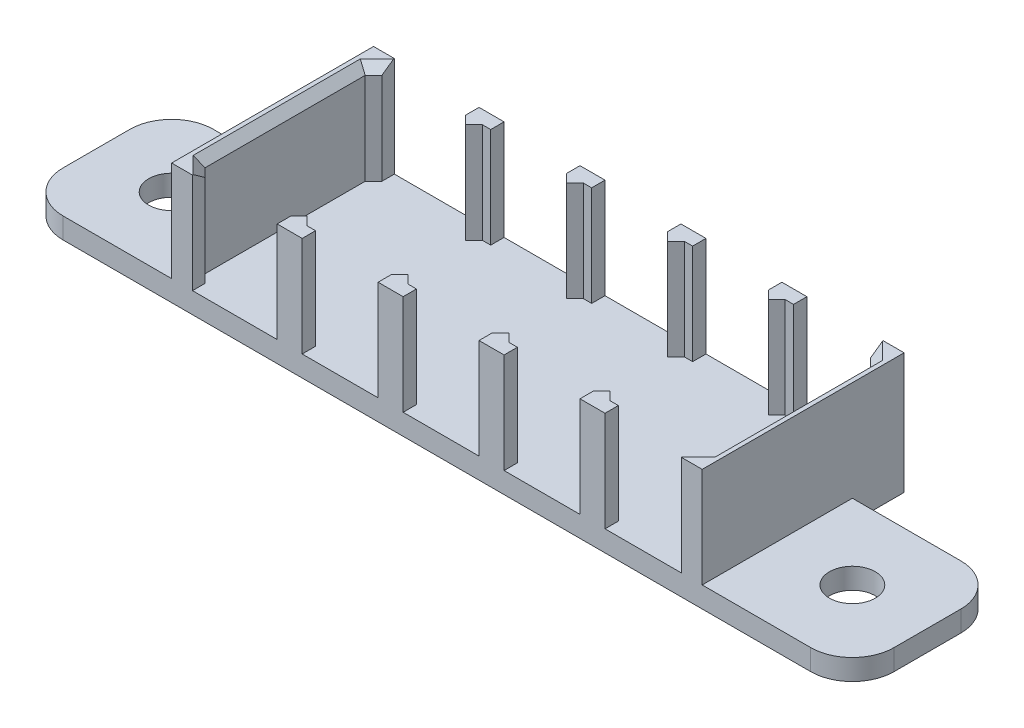
from build123d import *

# Parameters (mm, degrees)
SKETCH_1_W                    = 63.6
SKETCH_1_H                    = 24.2
EXTRUDE_1_DEPTH               = 2.5
SKETCH_2_R                    = 2.75
EXTRUDE_2_DEPTH               = 2.5
EXTRUDE_3_DEPTH               = 12
CHAMFER_1_SIZE                = 1
EXTRUDE_4_DEPTH               = 12
PATTERN_LINEAR_1_COPY_1_DEPTH = 12
PATTERN_LINEAR_1_COPY_2_DEPTH = 12
PATTERN_LINEAR_1_COPY_3_DEPTH = 12
PATTERN_LINEAR_1_COPY_4_DEPTH = 12
PATTERN_LINEAR_1_COPY_5_DEPTH = 12
PATTERN_LINEAR_1_COPY_6_DEPTH = 12


with BuildPart() as part:
    # Эскиз1 → Бобышка-Вытянуть1 (new body)
    with BuildSketch(Plane(origin=(0, 0, 0), x_dir=(1, 0, 0), z_dir=(0, 1, 0))):
        with Locations((0, 2.328571429)):
            Rectangle(SKETCH_1_W, SKETCH_1_H)
    extrude(amount=EXTRUDE_1_DEPTH)

    # Эскиз2 → Бобышка-Вытянуть2 (add)
    with BuildSketch(Plane(origin=(0, 0, 0), x_dir=(1, 0, 0), z_dir=(0, 1, 0))):
        with BuildLine():
            Line((-31.8, -9.771428571), (-44.8, -9.771428571))
            ThreePointArc((-44.8, -9.771428571), (-48.335533906, -8.306962477), (-49.8, -4.771428571))
            Line((-49.8, -4.771428571), (-49.8, 3.228571429))
            ThreePointArc((-49.8, 3.228571429), (-48.335533906, 6.764105335), (-44.8, 8.228571429))
            Line((-44.8, 8.228571429), (-31.8, 8.228571429))
            Line((-31.8, 8.228571429), (-31.8, -9.771428571))
        make_face()
        with Locations((-40.8, -0.771428571)):
            Circle(SKETCH_2_R, mode=Mode.SUBTRACT)
    extrude_2 = extrude(amount=EXTRUDE_2_DEPTH)

    # Зеркальное отражение1: Бобышка-Вытянуть2 across plane
    add(extrude_2.mirror(Plane(origin=(0, 0, 0), x_dir=(0, 0, 1), z_dir=(1, 0, 0))))

    # Эскиз3 → Бобышка-Вытянуть3 (add)
    with BuildSketch(Plane(origin=(0, 2.5, 0), x_dir=(1, 0, 0), z_dir=(0, 1, 0))):
        Polygon((-31.8, 14.428571429), (-30.3, 14.428571429), (-29.3, 14.428571429), (-29.3, 12.928571429), (-30.3, 11.928571429), (-30.3, -7.271428571), (-29.3, -8.271428571), (-29.3, -9.771428571), (-30.3, -9.771428571), (-31.8, -9.771428571), align=None)
    extrude_3 = extrude(amount=EXTRUDE_3_DEPTH)

    # Зеркальное отражение2: Бобышка-Вытянуть3 across plane
    add(extrude_3.mirror(Plane(origin=(0, 0, 0), x_dir=(0, 0, 1), z_dir=(1, 0, 0))))

    # Фаска1
    chamfer_1_edges = [part.edges().sort_by_distance(p)[0] for p in [
        (-29.8, 14.5, -12.428571429),
        (29.8, 14.5, -12.428571429),
        (-29.8, 14.5, 7.771428571),
        (-30.3, 14.5, -2.328571429),
        (29.8, 14.5, 7.771428571),
        (30.3, 14.5, -2.328571429),
    ]]
    chamfer(chamfer_1_edges, length=CHAMFER_1_SIZE)

    # Эскиз4 → Бобышка-Вытянуть4 (add)
    with BuildSketch(Plane(origin=(0, 2.5, 0), x_dir=(1, 0, 0), z_dir=(0, 1, 0))):
        Polygon((-18.15, -9.771428571), (-19.15, -9.771428571), (-19.15, -8.171428571), (-18.15, -7.171428571), (-17.15, -8.171428571), (-16.15, -8.171428571), (-16.15, -9.771428571), align=None)
    extrude_4 = extrude(amount=EXTRUDE_4_DEPTH)

    # Зеркальное отражение3: Бобышка-Вытянуть4 across plane
    add(extrude_4.mirror(Plane.XY.offset(-2.328571429)))

    # Линейный массив1 copy 1 sketch → Линейный массив1 copy 1 (add)
    with BuildSketch(Plane(origin=(12.1, 2.5, -4.657142857), x_dir=(1, 0, 0), z_dir=(0, 1, 0))):
        Polygon((-18.15, 9.771428571), (-19.15, 9.771428571), (-19.15, 8.171428571), (-18.15, 7.171428571), (-17.15, 8.171428571), (-16.15, 8.171428571), (-16.15, 9.771428571), align=None)
    extrude(amount=PATTERN_LINEAR_1_COPY_1_DEPTH)

    # Линейный массив1 copy 2 sketch → Линейный массив1 copy 2 (add)
    with BuildSketch(Plane(origin=(24.2, 2.5, -4.657142857), x_dir=(1, 0, 0), z_dir=(0, 1, 0))):
        Polygon((-18.15, 9.771428571), (-19.15, 9.771428571), (-19.15, 8.171428571), (-18.15, 7.171428571), (-17.15, 8.171428571), (-16.15, 8.171428571), (-16.15, 9.771428571), align=None)
    extrude(amount=PATTERN_LINEAR_1_COPY_2_DEPTH)

    # Линейный массив1 copy 3 sketch → Линейный массив1 copy 3 (add)
    with BuildSketch(Plane(origin=(36.3, 2.5, -4.657142857), x_dir=(1, 0, 0), z_dir=(0, 1, 0))):
        Polygon((-18.15, 9.771428571), (-19.15, 9.771428571), (-19.15, 8.171428571), (-18.15, 7.171428571), (-17.15, 8.171428571), (-16.15, 8.171428571), (-16.15, 9.771428571), align=None)
    extrude(amount=PATTERN_LINEAR_1_COPY_3_DEPTH)

    # Линейный массив1 copy 4 sketch → Линейный массив1 copy 4 (add)
    with BuildSketch(Plane(origin=(12.1, 2.5, 0), x_dir=(1, 0, 0), z_dir=(0, 1, 0))):
        Polygon((-18.15, -9.771428571), (-19.15, -9.771428571), (-19.15, -8.171428571), (-18.15, -7.171428571), (-17.15, -8.171428571), (-16.15, -8.171428571), (-16.15, -9.771428571), align=None)
    extrude(amount=PATTERN_LINEAR_1_COPY_4_DEPTH)

    # Линейный массив1 copy 5 sketch → Линейный массив1 copy 5 (add)
    with BuildSketch(Plane(origin=(24.2, 2.5, 0), x_dir=(1, 0, 0), z_dir=(0, 1, 0))):
        Polygon((-18.15, -9.771428571), (-19.15, -9.771428571), (-19.15, -8.171428571), (-18.15, -7.171428571), (-17.15, -8.171428571), (-16.15, -8.171428571), (-16.15, -9.771428571), align=None)
    extrude(amount=PATTERN_LINEAR_1_COPY_5_DEPTH)

    # Линейный массив1 copy 6 sketch → Линейный массив1 copy 6 (add)
    with BuildSketch(Plane(origin=(36.3, 2.5, 0), x_dir=(1, 0, 0), z_dir=(0, 1, 0))):
        Polygon((-18.15, -9.771428571), (-19.15, -9.771428571), (-19.15, -8.171428571), (-18.15, -7.171428571), (-17.15, -8.171428571), (-16.15, -8.171428571), (-16.15, -9.771428571), align=None)
    extrude(amount=PATTERN_LINEAR_1_COPY_6_DEPTH)


solid = part.part
